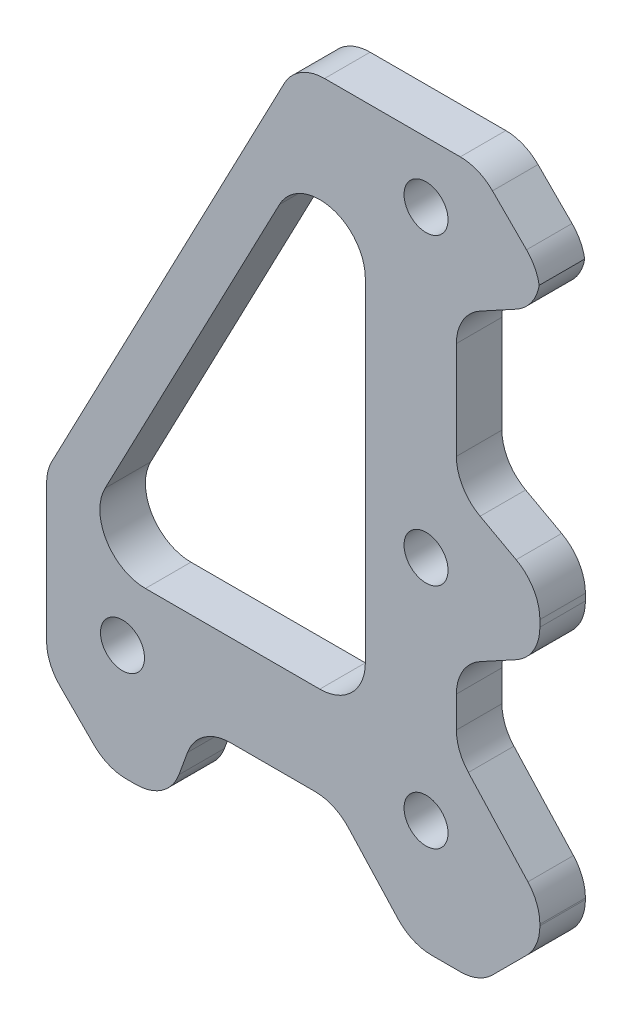
from build123d import *

# Parameters (mm, degrees)
SKETCH_1_R          = 1.45
EXTRUDE_1_DEPTH     = 3
CHAMFER_1_SIZE      = 4
CUT_EXTRUDE_1_DEPTH = 47.421977554
FILLET_1_R          = 3
FILLET_2_R          = 3


with BuildPart() as part:
    # 草图1 → 凸台-拉伸1 (new body)
    with BuildSketch(Plane.XY):
        Polygon((-25, 7.5), (-25, -7.5), (7.5, -7.5), (7.5, 39), (-8.5, 39), align=None)
        with Locations((-20, 0)):
            Circle(SKETCH_1_R, mode=Mode.SUBTRACT)
        Circle(SKETCH_1_R, mode=Mode.SUBTRACT)
        with Locations((0, 15)):
            Circle(SKETCH_1_R, mode=Mode.SUBTRACT)
        with Locations((0, 35)):
            Circle(SKETCH_1_R, mode=Mode.SUBTRACT)
        with BuildLine():
            Line((-9.657494606, 30.324817794), (-21.146102459, 8.392020984))
            ThreePointArc((-21.146102459, 8.392020984), (-21.055323941, 5.446948641), (-18.488607853, 4))
            Line((-18.488607853, 4), (-4, 4))
            Line((-4, 4), (-4, 28.93279681))
            ThreePointArc((-4, 28.93279681), (-6.283230796, 31.845912308), (-9.657494606, 30.324817794))
        make_face(mode=Mode.SUBTRACT)
    extrude(amount=EXTRUDE_1_DEPTH)

    # 倒角1
    chamfer_1_edges = [part.edges().sort_by_distance(p)[0] for p in [
        (7.5, 39, 1.5),
        (7.5, -7.5, 1.5),
        (-25, -7.5, 1.5),
    ]]
    chamfer(chamfer_1_edges, length=CHAMFER_1_SIZE)

    # 草图2 → 切除-拉伸1 (cut, through all)
    with BuildSketch(Plane.XY.offset(3)):
        Polygon((-17, -7.5), (-15, -2), (-6, -2), (-0.958333333, -7.5), align=None)
        Polygon((7.5, 33), (2, 30), (2, 20), (7.5, 17), align=None)
        Polygon((7.5, 13), (2, 10), (2, 5), (7.5, -1), align=None)
    extrude(amount=-CUT_EXTRUDE_1_DEPTH, mode=Mode.SUBTRACT)

    # 圆角1
    fillet_1_edges = [part.edges().sort_by_distance(p)[0] for p in [
        (-4, 4, 1.5),
    ]]
    fillet(fillet_1_edges, radius=FILLET_1_R)

    # 圆角2
    # the kernel refuses this fillet: 3 mm, written as the material it adds along each edge
    with BuildSketch(Plane(origin=(2, 5, 3), x_dir=(0, 1, 0), z_dir=(0, 0, -1))) as fillet_2_piece_1:
        with BuildLine():
            CenterArc((FILLET_2_R * 0.388983690555, FILLET_2_R), FILLET_2_R, 227.489552922, 42.510447078)
            Line((-FILLET_2_R * 0.286740937963, FILLET_2_R * 0.262845859799), (0, 0))
            Line((0, 0), (FILLET_2_R * 0.388983690555, 0))
        make_face()
    extrude(amount=3)
    with BuildSketch(Plane(origin=(2, 10, 3), x_dir=(0.8778955729143842, 0.4788521306805734, 0), z_dir=(0, 0, -1)), Plane(origin=(2, 20, 3), x_dir=(0, 1, 0), z_dir=(0, 0, -1)), Plane(origin=(2, 30, 3), x_dir=(0.8778955729143848, 0.4788521306805725, 0), z_dir=(0, 0, -1))) as fillet_2_piece_2:
        with BuildLine():
            CenterArc((FILLET_2_R * 0.59363309874, FILLET_2_R), FILLET_2_R, 208.610459666, 61.389540334)
            Line((-FILLET_2_R * 0.284262474174, FILLET_2_R * 0.521147869319), (0, 0))
            Line((0, 0), (FILLET_2_R * 0.59363309874, 0))
        make_face()
    extrude(amount=3)
    with BuildSketch(Plane(origin=(-15, -2, 3), x_dir=(1, 0, 0), z_dir=(0, 0, -1))) as fillet_2_piece_3:
        with BuildLine():
            CenterArc((FILLET_2_R * 0.700427264611, FILLET_2_R), FILLET_2_R, 199.983106522, 70.016893478)
            Line((-FILLET_2_R * 0.239366158878, FILLET_2_R * 0.658256936913), (0, 0))
            Line((0, 0), (FILLET_2_R * 0.700427264611, 0))
        make_face()
    extrude(amount=3)
    with BuildSketch(Plane(origin=(-6, -2, 3), x_dir=(0.6757246285173465, -0.7371541402007414, 0), z_dir=(0, 0, -1))) as fillet_2_piece_4:
        with BuildLine():
            CenterArc((FILLET_2_R * 0.439901716342, FILLET_2_R), FILLET_2_R, 222.510447078, 47.489552922)
            Line((-FILLET_2_R * 0.297252423859, FILLET_2_R * 0.324275371483), (0, 0))
            Line((0, 0), (FILLET_2_R * 0.439901716342, 0))
        make_face()
    extrude(amount=3)
    # the kernel refuses this fillet: 3 mm, written as the material it takes off along each edge
    with BuildSketch(Plane(origin=(7.5, 13, 7.452248241), x_dir=(0, 1, 0), z_dir=(0, 0, -1)), Plane(origin=(7.5, 33, 7.452248241), x_dir=(0, 1, 0), z_dir=(0, 0, -1)), Plane(origin=(7.5, 17, 7.452248241), x_dir=(-0.8778955729143842, 0.4788521306805734, 0), z_dir=(0, 0, -1))) as fillet_2_2_piece_1:
        with BuildLine():
            CenterArc((FILLET_2_R * 0.59363309874, -FILLET_2_R), FILLET_2_R, 90, 61.389540334)
            Line((-FILLET_2_R * 0.284262474174, -FILLET_2_R * 0.521147869319), (0, 0))
            Line((0, 0), (FILLET_2_R * 0.59363309874, 0))
        make_face()
    extrude(amount=11.904496481, mode=Mode.SUBTRACT)
    with BuildSketch(Plane(origin=(7.5, -1, 5.917377679), x_dir=(-0.6757246285173458, 0.7371541402007418, 0), z_dir=(0, 0, -1))) as fillet_2_2_piece_2:
        with BuildLine():
            CenterArc((FILLET_2_R * 0.388983690555, -FILLET_2_R), FILLET_2_R, 90, 42.510447078)
            Line((-FILLET_2_R * 0.286740937963, -FILLET_2_R * 0.262845859799), (0, 0))
            Line((0, 0), (FILLET_2_R * 0.388983690555, 0))
        make_face()
    extrude(amount=8.834755358, mode=Mode.SUBTRACT)
    with BuildSketch(Plane(origin=(3.5, -7.5, -3.106601718), x_dir=(0.7071067811865475, 0.7071067811865475, 0), z_dir=(0, 0, 1)), Plane(origin=(-21, -7.5, -3.106601718), x_dir=(1, 0, 0), z_dir=(0, 0, 1)), Plane(origin=(7.5, 35, -3.106601718), x_dir=(-0.7071067811865482, 0.7071067811865468, 0), z_dir=(0, 0, 1)), Plane(origin=(7.5, -3.5, -3.106601718), x_dir=(0, 1, 0), z_dir=(0, 0, 1)), Plane(origin=(3.5, 39, -3.106601718), x_dir=(-1, 0, 0), z_dir=(0, 0, 1))) as fillet_2_2_piece_3:
        with BuildLine():
            CenterArc((FILLET_2_R * 0.414213562373, FILLET_2_R), FILLET_2_R, 225, 45)
            Line((-FILLET_2_R * 0.292893218813, FILLET_2_R * 0.292893218813), (0, 0))
            Line((0, 0), (FILLET_2_R * 0.414213562373, 0))
        make_face()
    extrude(amount=9.213203436, mode=Mode.SUBTRACT)
    with BuildSketch(Plane(origin=(-25, -3.5, -3.106601718), x_dir=(0, 1, 0), z_dir=(0, 0, 1))) as fillet_2_2_piece_4:
        with BuildLine():
            CenterArc((FILLET_2_R * 0.414213562373, -FILLET_2_R), FILLET_2_R, 90, 45)
            Line((-FILLET_2_R * 0.292893218813, -FILLET_2_R * 0.292893218813), (0, 0))
            Line((0, 0), (FILLET_2_R * 0.414213562373, 0))
        make_face()
    extrude(amount=9.213203436, mode=Mode.SUBTRACT)
    with BuildSketch(Plane(origin=(-0.958333333, -7.5, 6.299262873), x_dir=(1, 0, 0), z_dir=(0, 0, -1))) as fillet_2_2_piece_5:
        with BuildLine():
            CenterArc((FILLET_2_R * 0.439901716342, -FILLET_2_R), FILLET_2_R, 90, 47.489552922)
            Line((-FILLET_2_R * 0.297252423859, -FILLET_2_R * 0.324275371483), (0, 0))
            Line((0, 0), (FILLET_2_R * 0.439901716342, 0))
        make_face()
    extrude(amount=9.598525745, mode=Mode.SUBTRACT)
    with BuildSketch(Plane(origin=(-17, -7.5, 8.253204485), x_dir=(0.341743063086704, 0.9397934234884372, 0), z_dir=(0, 0, -1))) as fillet_2_2_piece_6:
        with BuildLine():
            CenterArc((FILLET_2_R * 0.700427264611, -FILLET_2_R), FILLET_2_R, 90, 70.016893478)
            Line((-FILLET_2_R * 0.239366158878, -FILLET_2_R * 0.658256936913), (0, 0))
            Line((0, 0), (FILLET_2_R * 0.700427264611, 0))
        make_face()
    extrude(amount=13.506408969, mode=Mode.SUBTRACT)
    with BuildSketch(Plane(origin=(-8.5, 39, -4.538049708), x_dir=(-0.464006994670558, -0.8858315352801552, 0), z_dir=(0, 0, 1))) as fillet_2_2_piece_7:
        with BuildLine():
            CenterArc((FILLET_2_R * 0.605073294393, FILLET_2_R), FILLET_2_R, 207.645975364, 62.354024636)
            Line((-FILLET_2_R * 0.280758240887, FILLET_2_R * 0.535993005329), (0, 0))
            Line((0, 0), (FILLET_2_R * 0.605073294393, 0))
        make_face()
    extrude(amount=12.076099416, mode=Mode.SUBTRACT)
    with BuildSketch(Plane(origin=(-25, 7.5, -1.845367624), x_dir=(0, -1, 0), z_dir=(0, 0, 1))) as fillet_2_2_piece_8:
        with BuildLine():
            CenterArc((FILLET_2_R * 0.246049016569, FILLET_2_R), FILLET_2_R, 242.354024636, 27.645975364)
            Line((-FILLET_2_R * 0.217957978102, FILLET_2_R * 0.11416846472), (0, 0))
            Line((0, 0), (FILLET_2_R * 0.246049016569, 0))
        make_face()
    extrude(amount=6.690735249, mode=Mode.SUBTRACT)


solid = part.part
